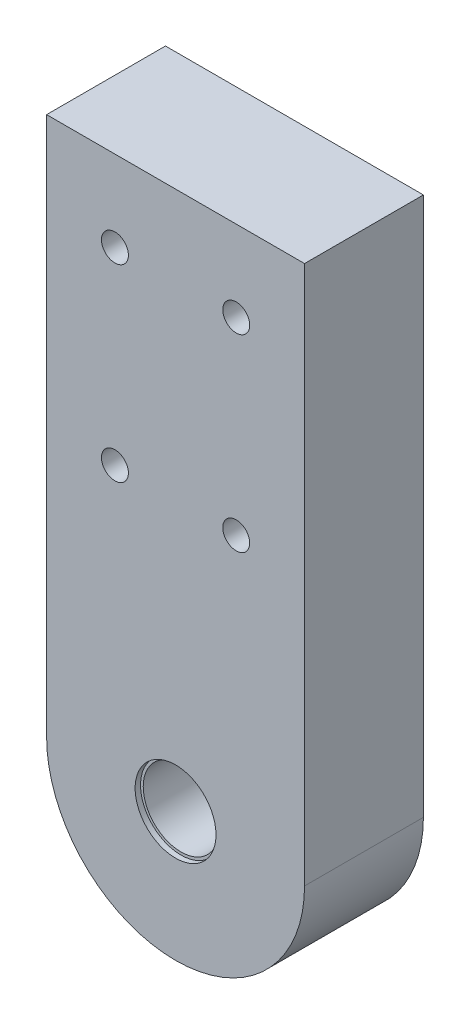
from build123d import *

# Parameters (mm, degrees)
SKETCH1_R           = 7
SKETCH1_R_2         = 2.5
BOSS_EXTRUDE1_DEPTH = 22.05
SKETCH2_R           = 7.5
CUT_EXTRUDE1_DEPTH  = 1
CUT_EXTRUDE2_START  = -1
SKETCH3_R           = 7.5
CUT_EXTRUDE2_DEPTH  = 1


with BuildPart() as part:
    # Sketch1 → Boss-Extrude1 (new body)
    with BuildSketch(Plane.XY):
        with BuildLine():
            Line((-23.925, 0), (-23.925, 100))
            Line((-23.925, 100), (23.925, 100))
            Line((23.925, 100), (23.925, 0))
            ThreePointArc((23.925, 0), (0, -23.925), (-23.925, 0))
        make_face()
        Circle(SKETCH1_R, mode=Mode.SUBTRACT)
        with Locations((-11.25, 85)):
            Circle(SKETCH1_R_2, mode=Mode.SUBTRACT)
        with Locations((11.25, 85)):
            Circle(SKETCH1_R_2, mode=Mode.SUBTRACT)
        with Locations((11.25, 50)):
            Circle(SKETCH1_R_2, mode=Mode.SUBTRACT)
        with Locations((-11.25, 50)):
            Circle(SKETCH1_R_2, mode=Mode.SUBTRACT)
    extrude(amount=BOSS_EXTRUDE1_DEPTH)

    # Sketch2 → Cut-Extrude1 (cut)
    with BuildSketch(Plane.XY.offset(22.05)):
        Circle(SKETCH2_R)
    extrude(amount=-CUT_EXTRUDE1_DEPTH, mode=Mode.SUBTRACT)

    # Sketch3 → Cut-Extrude2 (cut)
    with BuildSketch(Plane(origin=(0, 0, 0), x_dir=(-1, 0, 0), z_dir=(0, 0, -1)).offset(CUT_EXTRUDE2_START)):
        Circle(SKETCH3_R)
    extrude(amount=CUT_EXTRUDE2_DEPTH, mode=Mode.SUBTRACT)


solid = part.part
